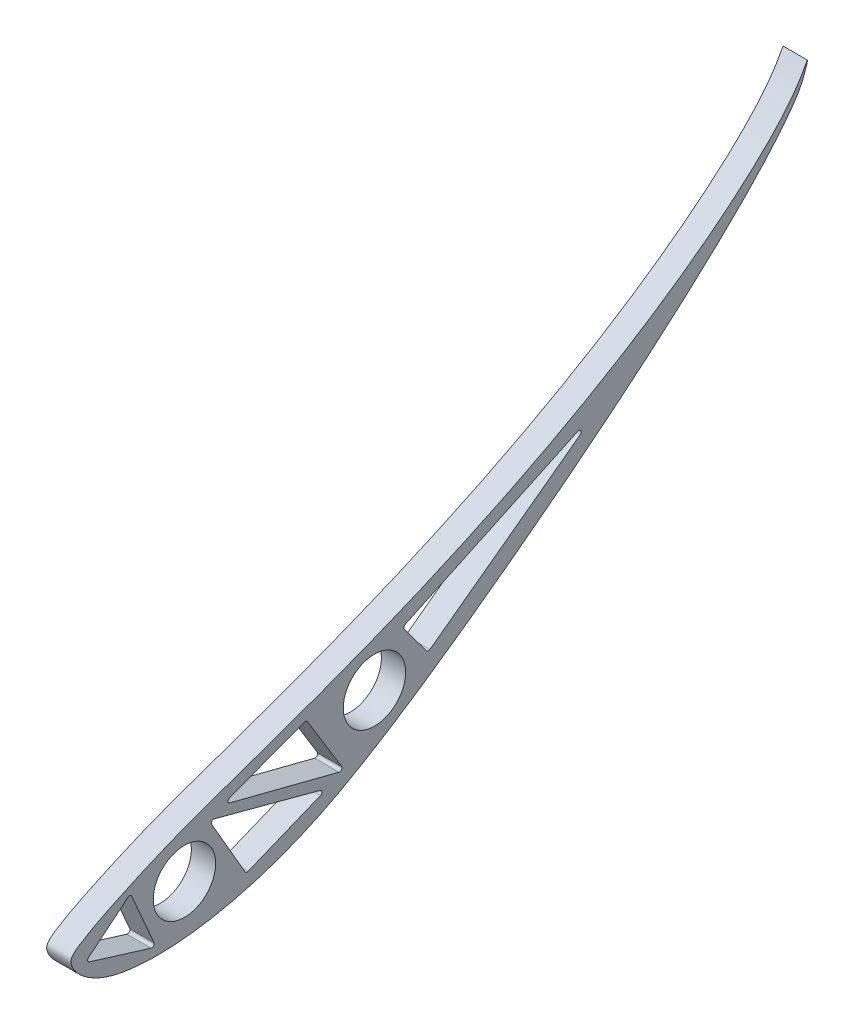
from build123d import *

# Parameters (mm, degrees)
SKETCH2_R           = 3.2639
BOSS_EXTRUDE1_DEPTH = 2.54


with BuildPart() as part:
    # Sketch2 → Boss-Extrude1 (new body)
    with BuildSketch(Plane.ZY.offset(668.2665959)):
        with BuildLine():
            add(Edge.make_bspline(
                [(1129.097011446, 190.685896851), (1129.148095963, 190.588111133), (1129.323630919, 190.269566278), (1129.840542173, 189.33717157), (1130.683008316, 188.106847302), (1131.963279489, 186.554596885), (1133.627934014, 184.831469506), (1135.65292472, 182.949969104), (1138.010564528, 180.961441709), (1140.679116166, 178.899421574), (1143.62744, 176.796992986), (1146.825009555, 174.687104599), (1150.233474254, 172.595300148), (1153.814439078, 170.546629142), (1157.527449827, 168.563077313), (1161.329152018, 166.660841179), (1165.176114355, 164.853367771), (1169.026852932, 163.153813452), (1172.836924367, 161.564269346), (1176.566730895, 160.089796876), (1180.175854205, 158.728781622), (1183.6282507, 157.477861297), (1186.888838836, 156.329388397), (1189.925915113, 155.271152181), (1192.718476384, 154.297667439), (1195.247426438, 153.346856261), (1197.517251541, 152.40054328), (1199.554992716, 151.507909873), (1201.353962227, 150.678931413), (1202.8946192, 149.920130777), (1204.168758712, 149.255426553), (1205.137213739, 148.649468063), (1205.839108171, 148.196057213), (1206.228826291, 147.629814428), (1206.075792706, 147.031181956), (1205.775826139, 146.455393129), (1205.265024828, 145.864815207), (1204.582557436, 145.299536969), (1203.728478788, 144.782328959), (1202.714927511, 144.329077319), (1201.532940335, 143.977009559), (1200.189890585, 143.730828694), (1198.693999846, 143.574626048), (1197.055073413, 143.524367662), (1195.286533958, 143.585811331), (1193.400470735, 143.762893771), (1191.409691457, 144.066745056), (1189.326253016, 144.494933513), (1187.165444407, 145.05676343), (1184.940418299, 145.756797678), (1182.667266934, 146.618211374), (1180.344960767, 147.640380109), (1177.977421187, 148.850612636), (1175.558256699, 150.239903404), (1173.065716925, 151.760208049), (1170.520006398, 153.41660688), (1167.926544305, 155.184752775), (1165.294570454, 157.044896923), (1162.635355534, 158.971425704), (1159.968778122, 160.945553623), (1157.313730844, 162.945429688), (1154.694480313, 164.960330292), (1152.130876047, 166.977181509), (1149.638996042, 168.982449144), (1147.237017664, 170.966734271), (1144.936945835, 172.915420541), (1142.75457142, 174.818498495), (1140.700852346, 176.661735349), (1138.788604236, 178.434350798), (1137.029141914, 180.125636579), (1135.432112798, 181.725134548), (1134.005261984, 183.222155939), (1132.75684346, 184.608774784), (1131.692332137, 185.876051491), (1130.816016525, 187.016900864), (1130.125824204, 188.02368546), (1129.630755398, 188.93710316), (1129.33974723, 189.727564946), (1129.164760651, 190.290278295), (1129.101906241, 190.505055492), (1129.097011445, 190.52171084)],
                knots=[0.002333001, 0.002333001, 0.002333001, 0.002333001, 0.004147435, 0.009748209, 0.018044377, 0.028864178, 0.04183079, 0.056713807, 0.073341232, 0.091507989, 0.111021837, 0.131661709, 0.153207715, 0.175433402, 0.198110317, 0.221011446, 0.243905882, 0.266573311, 0.288810349, 0.310405036, 0.331177743, 0.350943876, 0.3695564, 0.386864963, 0.402753039, 0.417195876, 0.430379519, 0.442362633, 0.453032156, 0.462284346, 0.470026206, 0.476176645, 0.480649947, 0.483553073, 0.486420689, 0.489953231, 0.494096927, 0.498850588, 0.50419675, 0.510125492, 0.516691031, 0.524011699, 0.532092122, 0.540897921, 0.550403414, 0.560581041, 0.571396483, 0.582828081, 0.594829641, 0.607347037, 0.620384325, 0.633968937, 0.648199967, 0.663193937, 0.678898581, 0.695226562, 0.712113221, 0.729459406, 0.747143117, 0.765009772, 0.782904928, 0.800688045, 0.818242105, 0.835449083, 0.852211621, 0.868429578, 0.884009363, 0.898854951, 0.912881827, 0.92601075, 0.938166771, 0.949289699, 0.959322172, 0.968216949, 0.97594822, 0.982474409, 0.987904723, 0.992516501, 0.996351138, 0.996675872, 0.996675872, 0.996675872, 0.996675872], degree=3))
            Line((1129.097011445, 190.685896851), (1129.097011445, 190.52171084))
        make_face()
        with BuildLine():
            Line((1171.265611372, 160.201726733), (1168.954245262, 157.064872727))
            ThreePointArc((1168.954245262, 157.064872727), (1168.787811646, 156.964411545), (1168.599088524, 157.0110611))
            Line((1168.599088524, 157.0110611), (1152.854303811, 168.612481415))
            ThreePointArc((1152.854303811, 168.612481415), (1152.786688766, 168.946836779), (1153.112791603, 169.046947933))
            Line((1153.112791603, 169.046947933), (1171.175604036, 160.579139341))
            ThreePointArc((1171.175604036, 160.579139341), (1171.308198239, 160.411322087), (1171.265611372, 160.201726733))
        make_face(mode=Mode.SUBTRACT)
        with BuildLine():
            ThreePointArc((1180.043568782, 149.499448411), (1179.885727756, 149.750616713), (1180.07366367, 149.98013664))
            Line((1180.07366367, 149.98013664), (1191.137547775, 152.936369982))
            ThreePointArc((1191.137547775, 152.936369982), (1191.40473579, 152.845462579), (1191.422996728, 152.563824284))
            Line((1191.422996728, 152.563824284), (1187.932802562, 146.528422224))
            ThreePointArc((1187.932802562, 146.528422224), (1187.795269791, 146.415296128), (1187.617258721, 146.420279693))
            Line((1187.617258721, 146.420279693), (1180.043568782, 149.499448411))
        make_face(mode=Mode.SUBTRACT)
        with BuildLine():
            ThreePointArc((1178.110615591, 150.649430522), (1177.843261646, 150.744486149), (1177.830811608, 151.027962251))
            Line((1177.830811608, 151.027962251), (1181.412472248, 156.886090304))
            ThreePointArc((1181.412472248, 156.886090304), (1181.546333972, 156.993706522), (1181.718076455, 156.991531376))
            Line((1181.718076455, 156.991531376), (1189.557655338, 154.06246735))
            ThreePointArc((1189.557655338, 154.06246735), (1189.722396687, 153.811011017), (1189.531855114, 153.578494548))
            Line((1189.531855114, 153.578494548), (1178.110615591, 150.649430522))
        make_face(mode=Mode.SUBTRACT)
        with Locations((1194.282457063, 148.838104533)):
            Circle(SKETCH2_R, mode=Mode.SUBTRACT)
        with BuildLine():
            Line((1197.46642821, 144.877290966), (1199.799951636, 150.249256352))
            ThreePointArc((1199.799951636, 150.249256352), (1199.973441392, 150.394994629), (1200.19426175, 150.344233321))
            Line((1200.19426175, 150.344233321), (1204.314389048, 146.955726762))
            ThreePointArc((1204.314389048, 146.955726762), (1204.402232095, 146.710322381), (1204.227667684, 146.516758495))
            Line((1204.227667684, 146.516758495), (1197.77401696, 144.533299668))
            ThreePointArc((1197.77401696, 144.533299668), (1197.510053453, 144.606784727), (1197.46642821, 144.877290966))
        make_face(mode=Mode.SUBTRACT)
        with Locations((1174.397734647, 156.224528624)):
            Circle(SKETCH2_R, mode=Mode.SUBTRACT)
    extrude(amount=BOSS_EXTRUDE1_DEPTH)


solid = part.part
